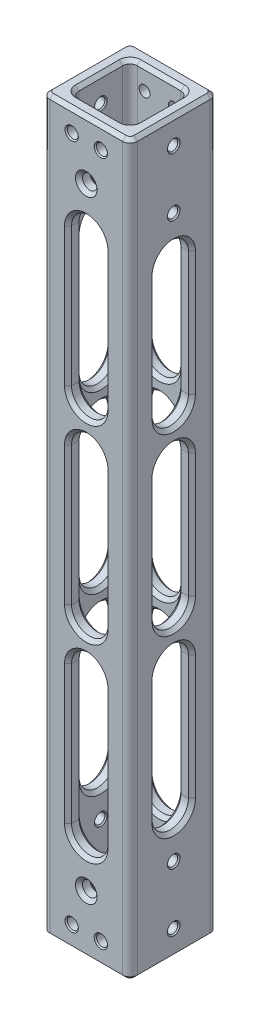
from build123d import *

# Parameters (mm, degrees)
SKETCH1_W                          = 19.05
SKETCH1_H                          = 19.05
SKETCH1_W_2                        = 12.7
SKETCH1_H_2                        = 12.7
BOSS_EXTRUDE1_DEPTH                = 79.375
F_1_8_0_125_DIAMETER_HOLE1_D       = 3.175
F_5_16_START                       = -9.525
F_5_16_0_3125_DIAMETER_SLOT1_DEPTH = 19.05
F_5_16_0_3125_DIAMETER_SLOT2_DEPTH = 19.05
F_4_40_TAPPED_HOLE1_D              = 2.2606
F_4_40_TAPPED_HOLE2_D              = 2.2606
F_3_32_0_09375_DIAMETER_HOLE1_D    = 2.38125
FILLET1_R                          = 1.5875
CHAMFER1_SIZE                      = 0.762
CHAMFER2_SIZE                      = 0.254


# Read off the part's stored shape, not the designer's step: 5/16 (0.3125) Diameter Slot1, 5/16 (0.3125) Diameter Slot2
with BuildPart() as part:
    # Sketch1 → Boss-Extrude1 (new, symmetric)
    with BuildSketch(Plane(origin=(0, 0, 0), x_dir=(1, 0, 0), z_dir=(0, 1, 0))):
        Rectangle(SKETCH1_W, SKETCH1_H)
        Rectangle(SKETCH1_W_2, SKETCH1_H_2, mode=Mode.SUBTRACT)
    extrude(amount=BOSS_EXTRUDE1_DEPTH, both=True)

    # 1/8 (0.125) Diameter Hole1 (through all)
    with Locations(Plane.XY.offset(9.525)):
        with Locations((0, 66.675), (0, -66.675)):
            Hole(F_1_8_0_125_DIAMETER_HOLE1_D / 2)

    # 5/16 (0.3125) Diameter Slot1 outline → 5/16 (0.3125) Diameter Slot1 (cut)
    with BuildSketch(Plane.XY.offset(F_5_16_START)):
        with BuildLine():
            Line((3.96875, -15.08125), (3.96875, 15.08125))
            ThreePointArc((3.96875, 15.08125), (0, 19.05), (-3.96875, 15.08125))
            Line((-3.96875, 15.08125), (-3.96875, -15.08125))
            ThreePointArc((-3.96875, -15.08125), (0, -19.05), (3.96875, -15.08125))
        make_face()
        with BuildLine():
            Line((3.96875, -56.35625), (3.96875, -26.19375))
            ThreePointArc((3.96875, -26.19375), (0, -22.225), (-3.96875, -26.19375))
            Line((-3.96875, -26.19375), (-3.96875, -56.35625))
            ThreePointArc((-3.96875, -56.35625), (0, -60.325), (3.96875, -56.35625))
        make_face()
        with BuildLine():
            Line((3.96875, 26.19375), (3.96875, 56.35625))
            ThreePointArc((3.96875, 56.35625), (0, 60.325), (-3.96875, 56.35625))
            Line((-3.96875, 56.35625), (-3.96875, 26.19375))
            ThreePointArc((-3.96875, 26.19375), (0, 22.225), (3.96875, 26.19375))
        make_face()
    extrude(amount=F_5_16_0_3125_DIAMETER_SLOT1_DEPTH, mode=Mode.SUBTRACT)

    # 5/16 (0.3125) Diameter Slot2 outline → 5/16 (0.3125) Diameter Slot2 (cut)
    with BuildSketch(Plane.YZ.offset(F_5_16_START)):
        with BuildLine():
            ThreePointArc((13.49375, -3.96875), (17.4625, 0), (13.49375, 3.96875))
            Line((13.49375, 3.96875), (-13.49375, 3.96875))
            ThreePointArc((-13.49375, 3.96875), (-17.4625, 0), (-13.49375, -3.96875))
            Line((-13.49375, -3.96875), (13.49375, -3.96875))
        make_face()
        with BuildLine():
            ThreePointArc((-24.60625, -3.96875), (-20.6375, 0), (-24.60625, 3.96875))
            Line((-24.60625, 3.96875), (-51.59375, 3.96875))
            ThreePointArc((-51.59375, 3.96875), (-55.5625, 0), (-51.59375, -3.96875))
            Line((-51.59375, -3.96875), (-24.60625, -3.96875))
        make_face()
        with BuildLine():
            ThreePointArc((51.59375, -3.96875), (55.5625, 0), (51.59375, 3.96875))
            Line((51.59375, 3.96875), (24.60625, 3.96875))
            ThreePointArc((24.60625, 3.96875), (20.6375, 0), (24.60625, -3.96875))
            Line((24.60625, -3.96875), (51.59375, -3.96875))
        make_face()
    extrude(amount=F_5_16_0_3125_DIAMETER_SLOT2_DEPTH, mode=Mode.SUBTRACT)

    # #4-40 Tapped Hole1 (through all)
    with Locations(Plane.ZY.offset(9.525)):
        with Locations((0, 73.81875), (0, 61.11875)):
            Hole(F_4_40_TAPPED_HOLE1_D / 2)

    # #4-40 Tapped Hole2 (through all)
    with Locations(Plane.ZY.offset(9.525)):
        with Locations((0, -61.11875), (0, -73.81875)):
            Hole(F_4_40_TAPPED_HOLE2_D / 2)

    # 3/32 (0.09375) Diameter Hole1 (through all)
    with Locations(Plane.XY.offset(9.525)):
        with Locations((-3.175, 74.6125), (3.175, 74.6125), (3.175, -74.6125), (-3.175, -74.6125)):
            Hole(F_3_32_0_09375_DIAMETER_HOLE1_D / 2)

    # Fillet1
    fillet1_edges = [part.edges().sort_by_distance(p)[0] for p in [
        (6.35, 0, 6.35),
        (6.35, 0, -6.35),
        (-6.35, 0, -6.35),
        (-6.35, 0, 6.35),
        (9.525, 0, 9.525),
        (-9.525, 0, 9.525),
        (-9.525, 0, -9.525),
        (9.525, 0, -9.525),
    ]]
    fillet(fillet1_edges, radius=FILLET1_R)

    # Chamfer1
    chamfer1_edges = [part.edges().sort_by_distance(p)[0] for p in [
        (3.96875, 41.275, 6.35),
        (0, 60.325, 6.35),
        (0, 22.225, 6.35),
        (-3.96875, 41.275, 6.35),
        (0, 22.225, -6.35),
        (0, 22.225, -9.525),
        (0, 60.325, -6.35),
        (-3.96875, 41.275, -6.35),
        (3.96875, 41.275, -6.35),
        (-3.96875, 41.275, 9.525),
        (0, 22.225, 9.525),
        (0, 60.325, 9.525),
        (3.96875, 41.275, -9.525),
        (0, 60.325, -9.525),
        (3.96875, 41.275, 9.525),
        (-3.96875, 41.275, -9.525),
        (6.35, 0, -3.96875),
        (6.35, -17.4625, 0),
        (6.35, 17.4625, 0),
        (6.35, 0, 3.96875),
        (-6.35, 17.4625, 0),
        (-6.35, -17.4625, 0),
        (-6.35, 0, 3.96875),
        (-9.525, -17.4625, 0),
        (9.525, 0, 3.96875),
        (-6.35, 0, -3.96875),
        (-9.525, 0, -3.96875),
        (9.525, 0, -3.96875),
        (9.525, 17.4625, 0),
        (9.525, -17.4625, 0),
        (-9.525, 0, 3.96875),
        (-9.525, 17.4625, 0),
        (-6.35, -38.1, -3.96875),
        (-6.35, -55.5625, 0),
        (-6.35, -20.6375, 0),
        (-6.35, -38.1, 3.96875),
        (6.35, -20.6375, 0),
        (6.35, -55.5625, 0),
        (6.35, -38.1, 3.96875),
        (9.525, -38.1, 3.96875),
        (6.35, -38.1, -3.96875),
        (9.525, -38.1, -3.96875),
        (9.525, -20.6375, 0),
        (9.525, -55.5625, 0),
        (-9.525, -38.1, 3.96875),
        (-9.525, -20.6375, 0),
        (-9.525, -55.5625, 0),
        (-9.525, -38.1, -3.96875),
        (-6.35, 38.1, 3.96875),
        (-6.35, 20.6375, 0),
        (-6.35, 55.5625, 0),
        (-6.35, 38.1, -3.96875),
        (6.35, 55.5625, 0),
        (6.35, 20.6375, 0),
        (6.35, 38.1, -3.96875),
        (6.35, 38.1, 3.96875),
        (9.525, 38.1, 3.96875),
        (9.525, 38.1, -3.96875),
        (9.525, 55.5625, 0),
        (9.525, 20.6375, 0),
        (-9.525, 38.1, 3.96875),
        (-9.525, 55.5625, 0),
        (-9.525, 20.6375, 0),
        (-9.525, 38.1, -3.96875),
        (0, -79.375, -9.525),
        (0, 79.375, -9.525),
        (9.525, -79.375, 0),
        (0, -79.375, 9.525),
        (-9.525, -79.375, 0),
        (0, -79.375, 6.35),
        (6.35, -79.375, 0),
        (0, -79.375, -6.35),
        (-6.35, -79.375, 0),
        (-9.060032015, -79.375, 9.060032015),
        (-9.060032015, -79.375, -9.060032015),
        (9.060032015, -79.375, 9.060032015),
        (9.060032015, -79.375, -9.060032015),
        (9.525, 79.375, 0),
        (-9.525, 79.375, 0),
        (0, 79.375, 9.525),
        (6.35, 79.375, 0),
        (0, 79.375, 6.35),
        (-6.35, 79.375, 0),
        (0, 79.375, -6.35),
        (-9.060032015, 79.375, 9.060032015),
        (-9.060032015, 79.375, -9.060032015),
        (9.060032015, 79.375, 9.060032015),
        (9.060032015, 79.375, -9.060032015),
        (5.885032015, -79.375, -5.885032015),
        (5.885032015, 79.375, -5.885032015),
        (5.885032015, -79.375, 5.885032015),
        (5.885032015, 79.375, 5.885032015),
        (-5.885032015, -79.375, 5.885032015),
        (-5.885032015, 79.375, 5.885032015),
        (-5.885032015, -79.375, -5.885032015),
        (-5.885032015, 79.375, -5.885032015),
        (1.5875, -66.675, 6.35),
        (1.5875, -66.675, -6.35),
        (1.5875, -66.675, -9.525),
        (1.5875, -66.675, 9.525),
        (1.5875, 66.675, 6.35),
        (1.5875, 66.675, -6.35),
        (1.5875, 66.675, -9.525),
        (1.5875, 66.675, 9.525),
        (3.96875, 0, 6.35),
        (0, 19.05, 6.35),
        (0, -19.05, 6.35),
        (0, -19.05, -6.35),
        (0, 19.05, -6.35),
        (0, 19.05, -9.525),
        (3.96875, 0, -6.35),
        (-3.96875, 0, -6.35),
        (-3.96875, 0, 6.35),
        (-3.96875, 0, -9.525),
        (-3.96875, 0, 9.525),
        (0, -19.05, 9.525),
        (0, 19.05, 9.525),
        (3.96875, 0, -9.525),
        (0, -19.05, -9.525),
        (3.96875, 0, 9.525),
        (0, -60.325, 6.35),
        (-3.96875, -41.275, 6.35),
        (0, -22.225, 6.35),
        (3.96875, -41.275, 6.35),
        (3.96875, -41.275, -6.35),
        (0, -22.225, -6.35),
        (0, -22.225, -9.525),
        (-3.96875, -41.275, -6.35),
        (-3.96875, -41.275, -9.525),
        (0, -60.325, -6.35),
        (0, -60.325, -9.525),
        (-3.96875, -41.275, 9.525),
        (0, -60.325, 9.525),
        (0, -22.225, 9.525),
        (3.96875, -41.275, -9.525),
        (3.96875, -41.275, 9.525),
    ]]
    chamfer(chamfer1_edges, length=CHAMFER1_SIZE)

    # Chamfer2
    chamfer2_edges = [part.edges().sort_by_distance(p)[0] for p in [
        (-6.35, 61.11875, 1.1303),
        (6.35, 61.11875, 1.1303),
        (9.525, 61.11875, 1.1303),
        (-9.525, 61.11875, 1.1303),
        (-6.35, 73.81875, 1.1303),
        (6.35, 73.81875, 1.1303),
        (9.525, 73.81875, 1.1303),
        (-9.525, 73.81875, 1.1303),
        (-6.35, -73.81875, 1.1303),
        (6.35, -73.81875, 1.1303),
        (9.525, -73.81875, 1.1303),
        (-9.525, -73.81875, 1.1303),
        (6.35, -61.11875, 1.1303),
        (-6.35, -61.11875, 1.1303),
        (-9.525, -61.11875, 1.1303),
        (9.525, -61.11875, 1.1303),
        (-1.984375, -74.6125, -9.525),
        (-1.984375, -74.6125, 9.525),
        (4.365625, -74.6125, 9.525),
        (4.365625, -74.6125, -9.525),
        (4.365625, 74.6125, 9.525),
        (4.365625, 74.6125, -9.525),
        (-1.984375, 74.6125, -9.525),
        (-1.984375, 74.6125, 9.525),
    ]]
    chamfer(chamfer2_edges, length=CHAMFER2_SIZE)


solid = part.part
